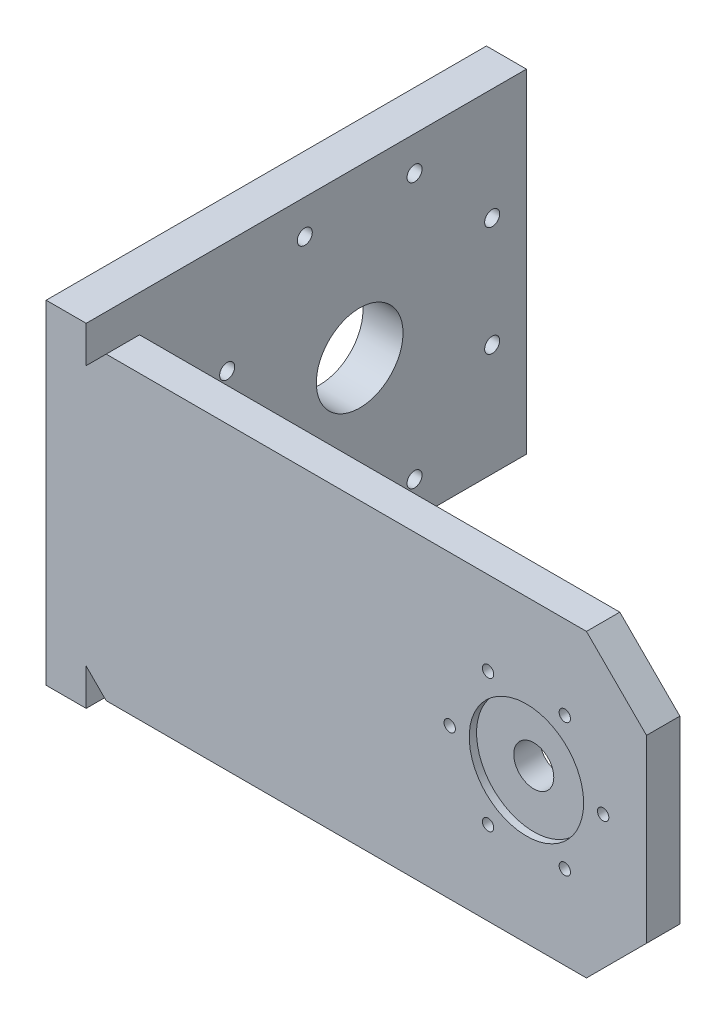
from build123d import *

# Parameters (mm, degrees)
SK_TOP_PLATE_R         = 1.7
SK_TOP_PLATE_R_2       = 6
TOP_PLATE_DEPTH        = 10
SK_YAW_PILOT_RECESS_R  = 17.15
YAW_PILOT_RECESS_DEPTH = 2.2
SK_BACK_PLATE_W        = 132
SK_BACK_PLATE_H        = 100
SK_BACK_PLATE_R        = 2.25
SK_BACK_PLATE_R_2      = 13
BACK_PLATE_DEPTH       = 12
RIB_DEPTH              = 8
SK_KEEL_W              = 58
SK_KEEL_H              = 15
KEEL_DEPTH             = 12


with BuildPart() as part:
    # SK_Top_Plate → Top_Plate (new body)
    with BuildSketch(Plane.XY.offset(72)):
        Polygon((-126, 45), (18, 45), (36, 27), (36, -27), (18, -45), (-126, -45), (-144, -27), (-144, 27), align=None)
        with Locations((23, 0)):
            Circle(SK_TOP_PLATE_R, mode=Mode.SUBTRACT)
        with Locations((11.5, -19.918584287)):
            Circle(SK_TOP_PLATE_R, mode=Mode.SUBTRACT)
        with Locations((-11.5, -19.918584287)):
            Circle(SK_TOP_PLATE_R, mode=Mode.SUBTRACT)
        with Locations((-23, 0)):
            Circle(SK_TOP_PLATE_R, mode=Mode.SUBTRACT)
        with Locations((-11.5, 19.918584287)):
            Circle(SK_TOP_PLATE_R, mode=Mode.SUBTRACT)
        with Locations((11.5, 19.918584287)):
            Circle(SK_TOP_PLATE_R, mode=Mode.SUBTRACT)
        Circle(SK_TOP_PLATE_R_2, mode=Mode.SUBTRACT)
    extrude(amount=TOP_PLATE_DEPTH)

    # SK_Yaw_Pilot_Recess → Yaw_Pilot_Recess (cut)
    with BuildSketch(Plane.XY.offset(82)):
        Circle(SK_YAW_PILOT_RECESS_R)
    extrude(amount=-YAW_PILOT_RECESS_DEPTH, mode=Mode.SUBTRACT)

    # SK_Back_Plate → Back_Plate (add)
    with BuildSketch(Plane(origin=(-144, 0, 0), x_dir=(0, 0, -1), z_dir=(1, 0, 0))):
        with Locations((-16, 0)):
            Rectangle(SK_BACK_PLATE_W, SK_BACK_PLATE_H)
        with Locations((39.726819898, -16.455387592)):
            Circle(SK_BACK_PLATE_R, mode=Mode.SUBTRACT)
        with Locations((16.455387592, -39.726819898)):
            Circle(SK_BACK_PLATE_R, mode=Mode.SUBTRACT)
        with Locations((-16.455387592, -39.726819898)):
            Circle(SK_BACK_PLATE_R, mode=Mode.SUBTRACT)
        with Locations((-39.726819898, -16.455387592)):
            Circle(SK_BACK_PLATE_R, mode=Mode.SUBTRACT)
        with Locations((-39.726819898, 16.455387592)):
            Circle(SK_BACK_PLATE_R, mode=Mode.SUBTRACT)
        with Locations((-16.455387592, 39.726819898)):
            Circle(SK_BACK_PLATE_R, mode=Mode.SUBTRACT)
        with Locations((16.455387592, 39.726819898)):
            Circle(SK_BACK_PLATE_R, mode=Mode.SUBTRACT)
        with Locations((39.726819898, 16.455387592)):
            Circle(SK_BACK_PLATE_R, mode=Mode.SUBTRACT)
        Circle(SK_BACK_PLATE_R_2, mode=Mode.SUBTRACT)
    extrude(amount=BACK_PLATE_DEPTH)

    # SK_Rib → Rib (add)
    with BuildSketch(Plane(origin=(0, -4, 0), x_dir=(1, 0, 0), z_dir=(0, 1, 0))):
        Polygon((-144, -52), (-30, -72), (-144, -72), align=None)
    extrude(amount=RIB_DEPTH)

    # SK_Keel → Keel (add)
    with BuildSketch(Plane(origin=(0, -6, 0), x_dir=(1, 0, 0), z_dir=(0, 1, 0))):
        with Locations((-115, -64.5)):
            Rectangle(SK_KEEL_W, SK_KEEL_H)
    extrude(amount=KEEL_DEPTH)


solid = part.part
